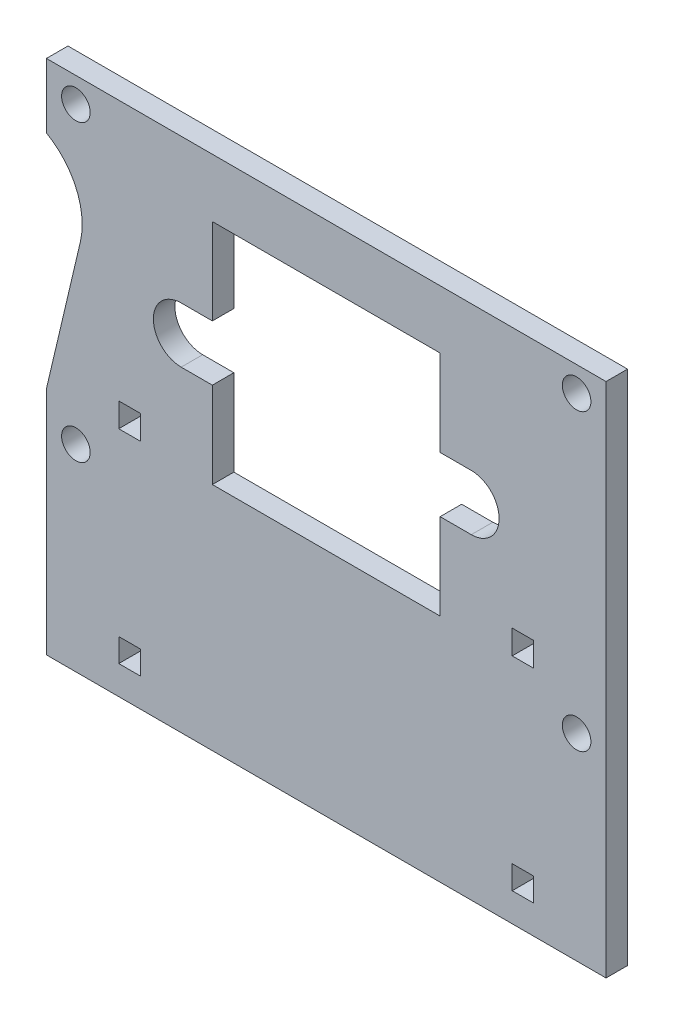
from build123d import *

# Parameters (mm, degrees)
SKETCH1_W           = 1.5875
SKETCH1_H           = 1.7272
SKETCH1_R           = 1.0541
SKETCH1_H_2         = 1.778
BOSS_EXTRUDE1_DEPTH = 1.5875


with BuildPart() as part:
    # Sketch1 → Boss-Extrude1 (new body)
    with BuildSketch(Plane.XY):
        with BuildLine():
            Line((-20.6375, 17), (-20.6375, 0))
            Line((-20.6375, 0), (20.6375, 0))
            Line((20.6375, 0), (20.6375, 38.1))
            Line((20.6375, 38.1), (-20.6375, 38.1))
            Line((-20.6375, 38.1), (-20.6375, 33.337040193))
            ThreePointArc((-20.6375, 33.337040193), (-18.435986441, 30.891808271), (-18.139452621, 27.61493647))
            Line((-18.139452621, 27.61493647), (-20.6375, 17))
        make_face()
        with Locations((-14.50975, 2.977543878)):
            Rectangle(SKETCH1_W, SKETCH1_H, mode=Mode.SUBTRACT)
        with Locations((-18.4658, 14.5415)):
            Circle(SKETCH1_R, mode=Mode.SUBTRACT)
        with Locations((-14.50975, 18.002943878)):
            Rectangle(SKETCH1_W, SKETCH1_H_2, mode=Mode.SUBTRACT)
        with Locations((14.50975, 2.977543878)):
            Rectangle(SKETCH1_W, SKETCH1_H, mode=Mode.SUBTRACT)
        with Locations((14.50975, 18.002943878)):
            Rectangle(SKETCH1_W, SKETCH1_H_2, mode=Mode.SUBTRACT)
        with Locations((18.4658, 14.5415)):
            Circle(SKETCH1_R, mode=Mode.SUBTRACT)
        with BuildLine():
            Line((-8.4, 17), (-8.4, 23.35))
            Line((-8.4, 23.35), (-10.7, 23.35))
            ThreePointArc((-10.7, 23.35), (-12.75, 25.4), (-10.7, 27.45))
            Line((-10.7, 27.45), (-8.4, 27.45))
            Line((-8.4, 27.45), (-8.4, 33.8))
            Line((-8.4, 33.8), (8.4, 33.8))
            Line((8.4, 33.8), (8.4, 27.45))
            Line((8.4, 27.45), (10.7, 27.45))
            ThreePointArc((10.7, 27.45), (12.75, 25.4), (10.7, 23.35))
            Line((10.7, 23.35), (8.4, 23.35))
            Line((8.4, 23.35), (8.4, 17))
            Line((8.4, 17), (-8.4, 17))
        make_face(mode=Mode.SUBTRACT)
        with Locations((-18.4658, 36.2585)):
            Circle(SKETCH1_R, mode=Mode.SUBTRACT)
        with Locations((18.4658, 36.2585)):
            Circle(SKETCH1_R, mode=Mode.SUBTRACT)
    extrude(amount=BOSS_EXTRUDE1_DEPTH)


solid = part.part
